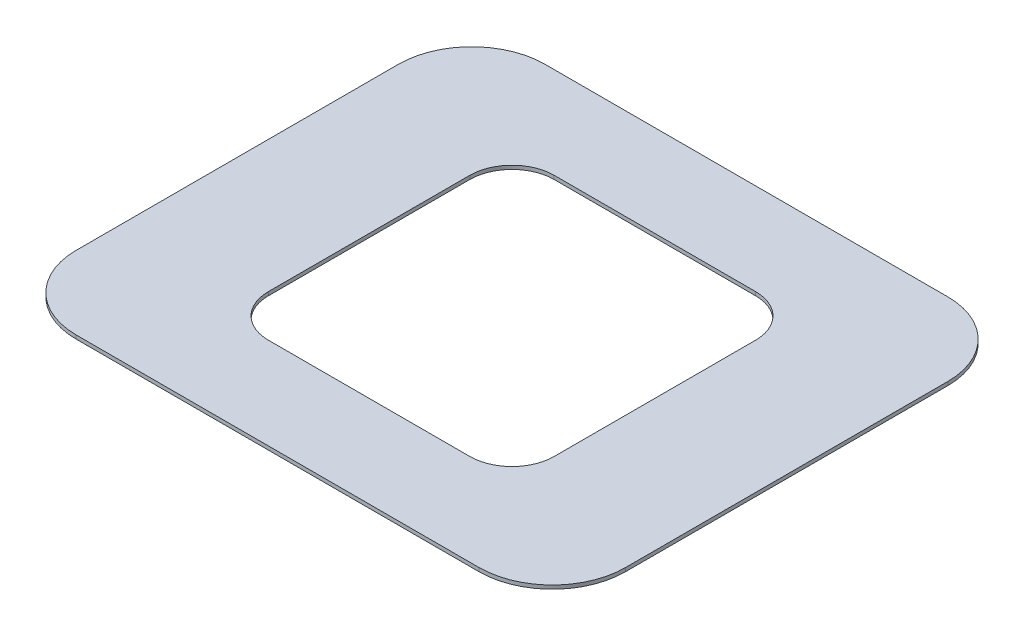
from build123d import *

# Parameters (mm, degrees)
BOSS_EXTRUDE1_DEPTH = 2


with BuildPart() as part:
    # Sketch1 → Boss-Extrude1 (new body)
    with BuildSketch(Plane(origin=(0, 0, 0), x_dir=(1, 0, 0), z_dir=(0, 1, 0))):
        with BuildLine():
            Line((-92.716981132, 79.594339623), (127.283018868, 79.594339623))
            ThreePointArc((127.283018868, 79.594339623), (155.567290115, 67.87861087), (167.283018868, 39.594339623))
            Line((167.283018868, 39.594339623), (167.283018868, -136.405660377))
            ThreePointArc((167.283018868, -136.405660377), (155.567290115, -164.689931625), (127.283018868, -176.405660377))
            Line((127.283018868, -176.405660377), (-92.716981132, -176.405660377))
            ThreePointArc((-92.716981132, -176.405660377), (-121.00125238, -164.689931625), (-132.716981132, -136.405660377))
            Line((-132.716981132, -136.405660377), (-132.716981132, 39.594339623))
            ThreePointArc((-132.716981132, 39.594339623), (-121.00125238, 67.87861087), (-92.716981132, 79.594339623))
        make_face()
        with BuildLine():
            Line((-37.716981132, 29.594339623), (72.283018868, 29.594339623))
            ThreePointArc((72.283018868, 29.594339623), (88.546474835, 22.85779559), (95.283018868, 6.594339623))
            Line((95.283018868, 6.594339623), (95.283018868, -103.405660377))
            ThreePointArc((95.283018868, -103.405660377), (88.546474835, -119.669116345), (72.283018868, -126.405660377))
            Line((72.283018868, -126.405660377), (-37.716981132, -126.405660377))
            ThreePointArc((-37.716981132, -126.405660377), (-53.980437099, -119.669116345), (-60.716981132, -103.405660377))
            Line((-60.716981132, -103.405660377), (-60.716981132, 6.594339623))
            ThreePointArc((-60.716981132, 6.594339623), (-53.980437099, 22.85779559), (-37.716981132, 29.594339623))
        make_face(mode=Mode.SUBTRACT)
    extrude(amount=BOSS_EXTRUDE1_DEPTH)


solid = part.part
